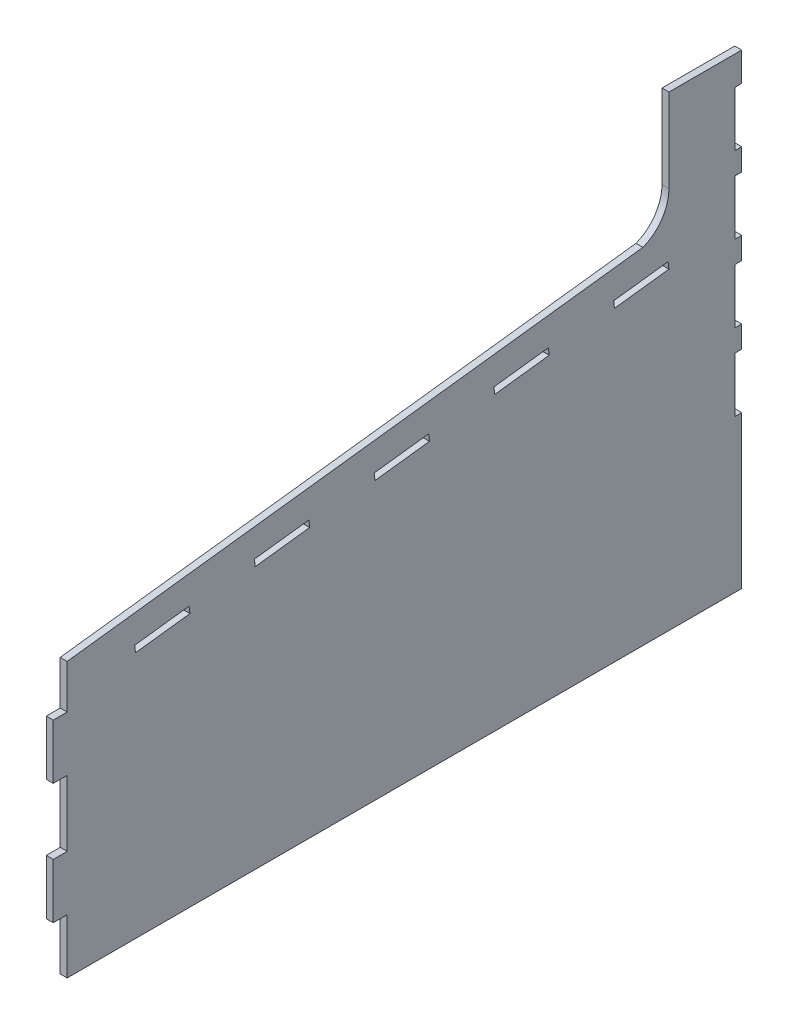
from build123d import *

# Parameters (mm, degrees)
BOSS_EXTRUDE1_DEPTH = 6.35
CUT_EXTRUDE1_DEPTH  = 6.35


with BuildPart() as part:
    # Sketch1 → Boss-Extrude1 (new body)
    with BuildSketch(Plane(origin=(0, 0, 0), x_dir=(0, 0, -1), z_dir=(1, 0, 0))):
        with BuildLine():
            Line((0, 250), (524.932454243, 314.453600898))
            ThreePointArc((524.932454243, 314.453600898), (542.149596776, 328.040353327), (548.65, 348.987300516))
            Line((548.65, 348.987300516), (548.65, 425.217300516))
            Line((548.65, 425.217300516), (615, 425.217300516))
            Line((615, 425.217300516), (615, 398.867300516))
            Line((615, 398.867300516), (608.65, 398.867300516))
            Line((608.65, 398.867300516), (608.65, 348.867300516))
            Line((608.65, 348.867300516), (615, 348.867300516))
            Line((615, 348.867300516), (615, 328.901533677))
            Line((615, 328.901533677), (608.65, 328.901533677))
            Line((608.65, 328.901533677), (608.65, 278.901533677))
            Line((608.65, 278.901533677), (615, 278.901533677))
            Line((615, 278.901533677), (615, 258.935766839))
            Line((615, 258.935766839), (608.65, 258.935766839))
            Line((608.65, 258.935766839), (608.65, 208.935766839))
            Line((608.65, 208.935766839), (615, 208.935766839))
            Line((615, 208.935766839), (615, 188.97))
            Line((615, 188.97), (608.65, 188.97))
            Line((608.65, 188.97), (608.65, 138.97))
            Line((608.65, 138.97), (615, 138.97))
            Line((615, 138.97), (615, 0))
            Line((615, 0), (0, 0))
            Line((0, 0), (0, 50))
            Line((0, 50), (-12.7, 50))
            Line((-12.7, 50), (-12.7, 100))
            Line((-12.7, 100), (0, 100))
            Line((0, 100), (0, 160))
            Line((0, 160), (-12.7, 160))
            Line((-12.7, 160), (-12.7, 210))
            Line((-12.7, 210), (0, 210))
            Line((0, 210), (0, 250))
        make_face()
    extrude(amount=BOSS_EXTRUDE1_DEPTH)

    # Sketch2 → Cut-Extrude1 (cut)
    with BuildSketch(Plane(origin=(6.35, 0, 0), x_dir=(0, 0, -1), z_dir=(1, 0, 0))):
        Polygon((61.537861402, 231.965149724), (62.311731732, 225.662481662), (111.939039314, 231.755948832), (111.165168984, 238.058616895), align=None)
        Polygon((220.345245664, 251.464244669), (170.717938082, 245.370777499), (171.491808413, 239.068109436), (221.119115995, 245.161576606), align=None)
        Polygon((329.525322345, 264.869872444), (279.898014763, 258.776405274), (280.671885093, 252.473737211), (330.299192676, 258.567204381), align=None)
        Polygon((438.705399025, 278.275500218), (389.078091443, 272.182033048), (389.851961774, 265.879364985), (439.479269356, 271.972832155), align=None)
        Polygon((547.885475706, 291.681127993), (498.258168124, 285.587660823), (499.032038455, 279.28499276), (548.659346037, 285.37845993), align=None)
    extrude(amount=-CUT_EXTRUDE1_DEPTH, mode=Mode.SUBTRACT)


solid = part.part
